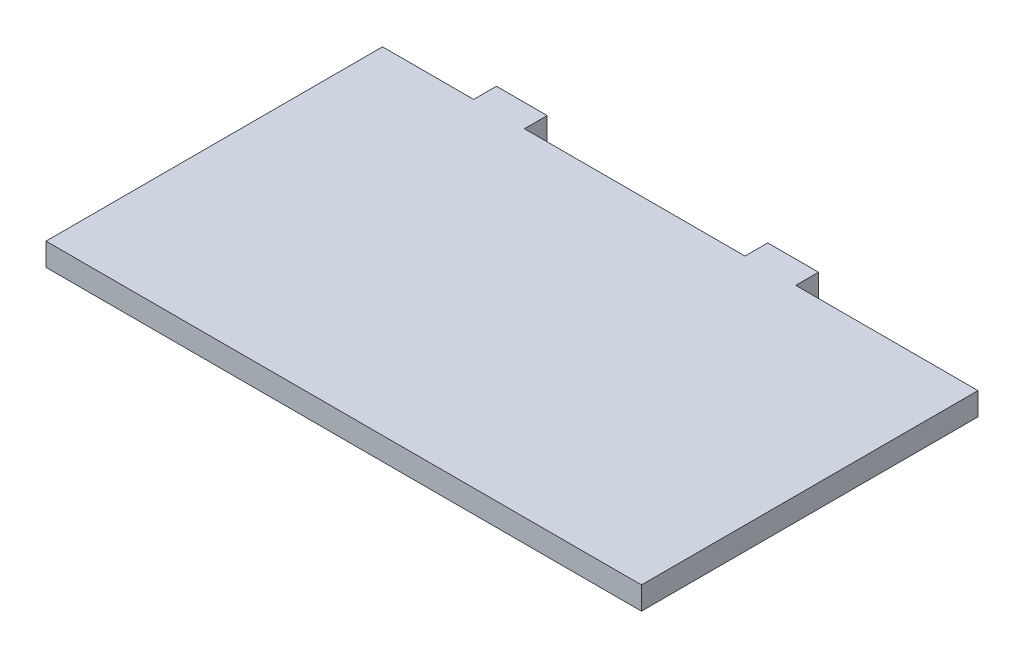
from build123d import *

# Parameters (mm, degrees)
BOSS_EXTRUDE1_DEPTH = 5.588


with BuildPart() as part:
    # Sketch1 → Boss-Extrude1 (new body)
    with BuildSketch(Plane(origin=(0, 0, 0), x_dir=(1, 0, 0), z_dir=(0, 1, 0))):
        Polygon((-73.025, -41.275), (73.025, -41.275), (73.025, 41.275), (28.321, 41.275), (28.321, 46.863), (15.875, 46.863), (15.875, 41.275), (-38.227, 41.275), (-38.227, 46.863), (-50.673, 46.863), (-50.673, 41.275), (-73.025, 41.275), align=None)
    extrude(amount=BOSS_EXTRUDE1_DEPTH)


solid = part.part
